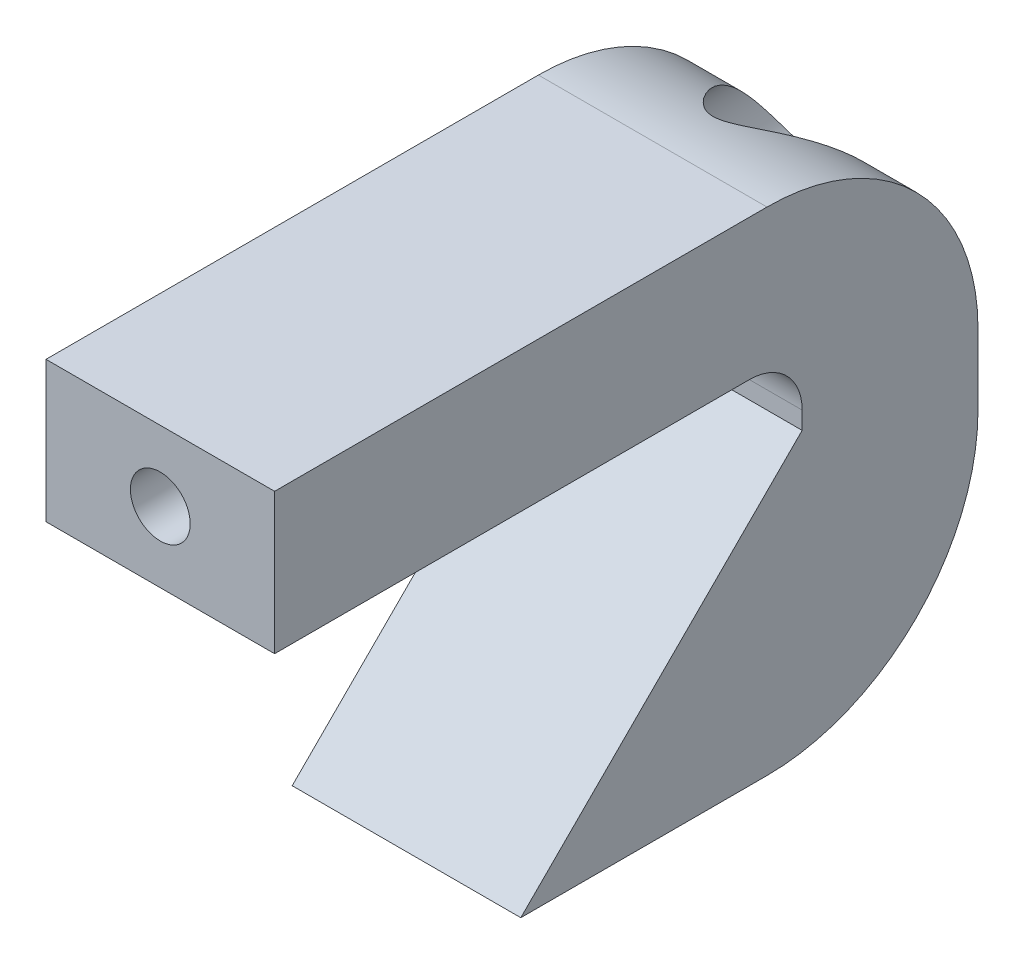
from build123d import *

# Parameters (mm, degrees)
BOSS_EXTRUDE1_DEPTH                                 = 13
FILLET2_R                                           = 12
FILLET4_R                                           = 3
SKETCH2_R                                           = 1.7
CUT_EXTRUDE1_DEPTH                                  = 41
SKETCH3_R                                           = 3.5
CUT_EXTRUDE2_DEPTH                                  = 34
CSK_FOR_M3_COUNTERSUNK_FLAT_HEAD_SCREW1_D           = 3.2
CSK_FOR_M3_COUNTERSUNK_FLAT_HEAD_SCREW1_CSINK_D     = 6.3
CSK_FOR_M3_COUNTERSUNK_FLAT_HEAD_SCREW1_CSINK_ANGLE = 90


with BuildPart() as part:
    # Sketch1 → Boss-Extrude1 (new body)
    with BuildSketch(Plane(origin=(0, 0, 0), x_dir=(0, 0, -1), z_dir=(1, 0, 0))):
        Polygon((0, -16), (-16, -16), (0, 0), (0, 4), (-30, 4), (-30, 12), (10, 12), (10, -16), align=None)
    extrude(amount=BOSS_EXTRUDE1_DEPTH)

    # Fillet2
    fillet2_edges = [part.edges().sort_by_distance(p)[0] for p in [
        (6.5, 12, -10),
        (6.5, -16, -10),
    ]]
    fillet(fillet2_edges, radius=FILLET2_R)

    # Fillet4
    fillet4_edges = [part.edges().sort_by_distance(p)[0] for p in [
        (6.5, 4, 0),
    ]]
    fillet(fillet4_edges, radius=FILLET4_R)

    # Sketch2 → Cut-Extrude1 (cut)
    with BuildSketch(Plane(origin=(0, 0, -10), x_dir=(-1, 0, 0), z_dir=(0, 0, -1))):
        with Locations((-6.5, 8)):
            Circle(SKETCH2_R)
    extrude(amount=-CUT_EXTRUDE1_DEPTH, mode=Mode.SUBTRACT)

    # Sketch3 → Cut-Extrude2 (cut)
    with BuildSketch(Plane(origin=(0, 0, -10), x_dir=(-1, 0, 0), z_dir=(0, 0, -1))):
        with Locations((-6.5, 8)):
            Circle(SKETCH3_R)
    extrude(amount=-CUT_EXTRUDE2_DEPTH, mode=Mode.SUBTRACT)

    # CSK for M3 Countersunk Flat Head Screw1 (through all)
    with Locations(Plane(origin=(0, 0, 24), x_dir=(-1, 0, 0), z_dir=(0, 0, -1))):
        with Locations((-6.5, 8.017557195)):
            CounterSinkHole(CSK_FOR_M3_COUNTERSUNK_FLAT_HEAD_SCREW1_D / 2, CSK_FOR_M3_COUNTERSUNK_FLAT_HEAD_SCREW1_CSINK_D / 2, counter_sink_angle=CSK_FOR_M3_COUNTERSUNK_FLAT_HEAD_SCREW1_CSINK_ANGLE)


solid = part.part
